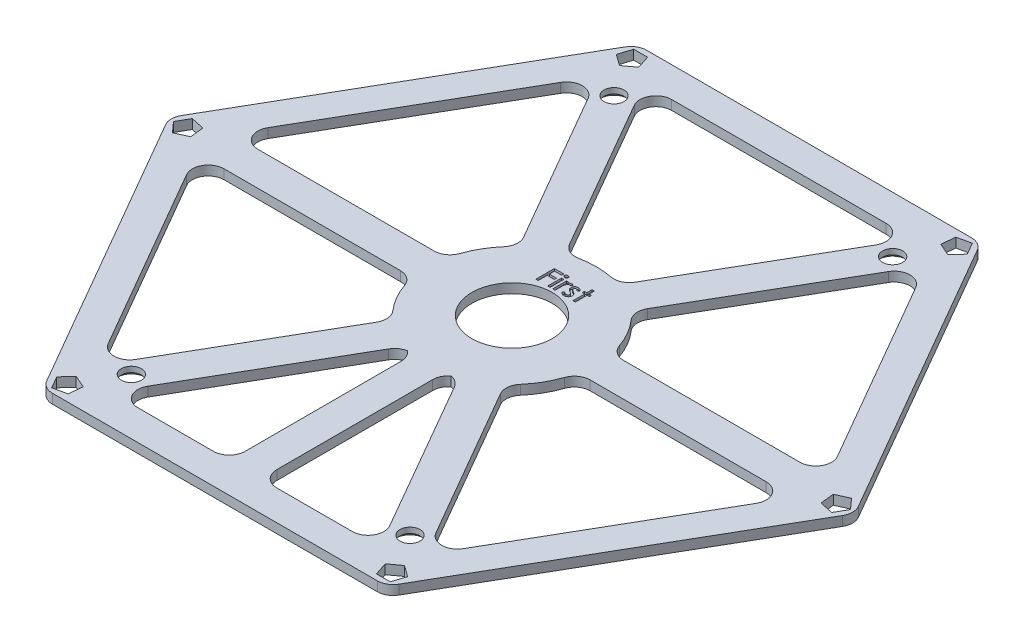
from build123d import *

# Parameters (mm, degrees)
SKETCH1_R           = 1.9
BOSS_EXTRUDE1_DEPTH = 1.8
FILLET1_R           = 3
FILLET2_R           = 3
SKETCH3_R           = 7.6
CUT_EXTRUDE1_DEPTH  = 10
SKETCH4_W           = 0.448717948
SKETCH4_H           = 2.602564103
CUT_EXTRUDE2_DEPTH  = 0.4
CHAMFER1_SIZE       = 0.75
SCALE1_SCALE        = 1.15


with BuildPart() as part:
    # Sketch1 → Boss-Extrude1 (new body)
    with BuildSketch(Plane(origin=(0, 0, 0), x_dir=(1, 0, 0), z_dir=(0, 1, 0))):
        Polygon((-32.5, 56.291651246), (-65, 0), (-32.5, -56.291651246), (32.5, -56.291651246), (65, 0), (32.5, 56.291651246), align=None)
        with Locations(Location((-26.4, 45.72614132, 0), (0, 0, 270))):
            Circle(SKETCH1_R, mode=Mode.SUBTRACT)
        with Locations(Location((26.4, 45.72614132, 0), (0, 0, 270))):
            Circle(SKETCH1_R, mode=Mode.SUBTRACT)
        with Locations(Location((26.4, -45.72614132, 0), (0, 0, 270))):
            Circle(SKETCH1_R, mode=Mode.SUBTRACT)
        with Locations(Location((-26.4, -45.72614132, 0), (0, 0, 270))):
            Circle(SKETCH1_R, mode=Mode.SUBTRACT)
        with BuildLine():
            Line((-31.050008497, 47.37157487), (-56.549991503, 3.204308711))
            Line((-56.549991503, 3.204308711), (-15.675854225, 3.204308711))
            ThreePointArc((-15.675854225, 3.204308711), (-13.856406461, 8), (-10.612939858, 11.973533629))
            Line((-10.612939858, 11.973533629), (-31.050008497, 47.37157487))
        make_face(mode=Mode.SUBTRACT)
        with BuildLine():
            Line((-56.549991503, -3.204308711), (-31.050008497, -47.37157487))
            Line((-31.050008497, -47.37157487), (-10.612939858, -11.973533629))
            ThreePointArc((-10.612939858, -11.973533629), (-13.856406461, -8), (-15.675854225, -3.204308711))
            Line((-15.675854225, -3.204308711), (-56.549991503, -3.204308711))
        make_face(mode=Mode.SUBTRACT)
        with BuildLine():
            Line((-25.499983006, -50.575883581), (-3, -50.575883581))
            Line((-3, -50.575883581), (-3, -15.716233646))
            ThreePointArc((-3, -15.716233646), (-4.040434794, -15.481436842), (-5.062914367, -15.17784234))
            Line((-5.062914367, -15.17784234), (-25.499983006, -50.575883581))
        make_face(mode=Mode.SUBTRACT)
        with BuildLine():
            Line((31.050008497, -47.37157487), (56.549991503, -3.204308711))
            Line((56.549991503, -3.204308711), (15.685493875, -3.156783473))
            ThreePointArc((15.685493875, -3.156783473), (13.8685138, -7.978992729), (10.612939858, -11.973533629))
            Line((10.612939858, -11.973533629), (31.050008497, -47.37157487))
        make_face(mode=Mode.SUBTRACT)
        with BuildLine():
            Line((56.549991503, 3.204308711), (31.050008497, 47.37157487))
            Line((31.050008497, 47.37157487), (10.576601619, 12.00564443))
            ThreePointArc((10.576601619, 12.00564443), (13.8442673, 8.020988899), (15.675854225, 3.204308711))
            Line((15.675854225, 3.204308711), (56.549991503, 3.204308711))
        make_face(mode=Mode.SUBTRACT)
        with BuildLine():
            Line((25.499983006, 50.575883581), (-25.499983006, 50.575883581))
            Line((-25.499983006, 50.575883581), (-5.108892256, 15.162427903))
            ThreePointArc((-5.108892256, 15.162427903), (-0.0242465, 15.999981628), (5.062914367, 15.17784234))
            Line((5.062914367, 15.17784234), (25.499983006, 50.575883581))
        make_face(mode=Mode.SUBTRACT)
        Polygon((28.926541222, 52.315471461), (31.319181202, 51.258876955), (33.063428707, 53.207907141), (31.748792971, 55.469068546), (29.192055897, 54.917512964), align=None, mode=Mode.SUBTRACT)
        Polygon((-30.843256685, 51.208855273), (-28.731899012, 52.752645025), (-29.547684912, 55.237722767), (-32.163226, 55.229795525), (-32.963933391, 52.739818478), align=None, mode=Mode.SUBTRACT)
        with BuildLine():
            Line((5.108892256, -15.162427903), (25.499983006, -50.575883581))
            Line((25.499983006, -50.575883581), (3, -50.575883581))
            Line((3, -50.575883581), (3, -15.716233646))
            ThreePointArc((3, -15.716233646), (4.063890821, -15.475296165), (5.108892256, -15.162427903))
        make_face(mode=Mode.SUBTRACT)
        Polygon((59.769797908, 1.106616188), (60.051080214, -1.493768069), (62.61111362, -2.029815626), (63.912018971, 0.239273021), (62.155989288, 2.177694486), align=None, mode=Mode.SUBTRACT)
        Polygon((30.843256685, -51.208855273), (28.731899012, -52.752645025), (29.547684912, -55.237722767), (32.163226, -55.229795525), (32.963933391, -52.739818478), align=None, mode=Mode.SUBTRACT)
        Polygon((-28.926541222, -52.315471461), (-31.319181202, -51.258876955), (-33.063428707, -53.207907141), (-31.748792971, -55.469068546), (-29.192055897, -54.917512964), align=None, mode=Mode.SUBTRACT)
        Polygon((-59.769797908, -1.106616188), (-60.051080214, 1.493768069), (-62.61111362, 2.029815626), (-63.912018971, -0.239273021), (-62.155989288, -2.177694486), align=None, mode=Mode.SUBTRACT)
    extrude(amount=BOSS_EXTRUDE1_DEPTH)

    # Fillet1
    fillet1_edges = [part.edges().sort_by_distance(p)[0] for p in [
        (32.5, 0.9, -56.291651246),
        (65, 0.9, 0),
        (32.5, 0.9, 56.291651246),
        (-32.5, 0.9, 56.291651246),
        (-65, 0.9, 0),
        (-32.5, 0.9, -56.291651246),
    ]]
    fillet(fillet1_edges, radius=FILLET1_R)

    # Fillet2
    # the kernel refuses this fillet: 3 mm, written as the material it adds along each edge
    with BuildSketch(Plane(origin=(5.108892256, 0, 15.162427903), x_dir=(0.49899247865454727, 0, 0.8666063156048375), z_dir=(0, 1, 0))) as fillet2_piece_1:
        with BuildLine():
            CenterArc((2.291900346, -3), FILLET2_R, 90, 71.150645984)
            ThreePointArc((-0.547213591, -2.03075697), (-0.240202934, -1.024379585), (0, 0))
            Line((0, 0), (2.291900346, 0))
        make_face()
    extrude(amount=1.8)
    with BuildSketch(Plane(origin=(3, 0, 15.716233646), x_dir=(0, 0, 1), z_dir=(0, 1, 0))) as fillet2_piece_2:
        with BuildLine():
            CenterArc((2.311522732, 3), FILLET2_R, 198.408480171, 71.591519829)
            ThreePointArc((-0.534965117, 2.052631579), (-0.233429176, 1.035190919), (0, 0))
            Line((0, 0), (2.311522732, 0))
        make_face()
    extrude(amount=1.8)
    with BuildSketch(Plane(origin=(3, 0, 50.575883581), x_dir=(1, 0, 0), z_dir=(0, 1, 0)), Plane(origin=(-3, 0, 50.575883581), x_dir=(0, 0, -1), z_dir=(0, 1, 0))) as fillet2_piece_3:
        with BuildLine():
            CenterArc((FILLET2_R, FILLET2_R), FILLET2_R, 180, 90)
            Line((0, FILLET2_R), (0, 0))
            Line((0, 0), (FILLET2_R, 0))
        make_face()
    extrude(amount=1.8)
    with BuildSketch(Plane(origin=(25.499983006, 0, 50.575883581), x_dir=(-0.49899247865454704, 0, -0.8666063156048377), z_dir=(0, 1, 0)), Plane(origin=(-25.499983006, 0, -50.575883581), x_dir=(0.49899247865454854, 0, 0.8666063156048366), z_dir=(0, 1, 0)), Plane(origin=(31.050008497, 0, -47.37157487), x_dir=(-0.5010068450665456, 0, 0.8654433206146238), z_dir=(0, 1, 0)), Plane(origin=(56.549991503, 0, 3.204308711), x_dir=(-0.9999993237210977, 0, -0.0011629949902190024), z_dir=(0, 1, 0))) as fillet2_piece_4:
        with BuildLine():
            CenterArc((FILLET2_R * 1.72972715714, FILLET2_R), FILLET2_R, 150.06663472, 119.93336528)
            Line((FILLET2_R * 0.86312084154, FILLET2_R * 1.49899247865), (0, 0))
            Line((0, 0), (FILLET2_R * 1.72972715714, 0))
        make_face()
    extrude(amount=1.8)
    with BuildSketch(Plane(origin=(-5.108892256, 0, -15.162427903), x_dir=(0.9665890145022106, 0, -0.25633118624865964), z_dir=(0, 1, 0)), Plane(origin=(10.576601619, 0, -12.00564443), x_dir=(0.7052838263247353, 0, 0.7089250484534599), z_dir=(0, 1, 0)), Plane(origin=(15.685493875, 0, 3.156783473), x_dir=(-0.2613051881774713, 0, 0.965256234702235), z_dir=(0, 1, 0))) as fillet2_piece_5:
        with BuildLine():
            CenterArc((2.30036625, 2.993513373), FILLET2_R, 195.08088677, 71.150645984)
            Line((-0.596312186, 2.212966103), (0, 0))
            ThreePointArc((0, 0), (1.051596, 0.034595343), (2.103192, 0))
        make_face()
    extrude(amount=1.8)
    with BuildSketch(Plane(origin=(5.062914367, 0, -15.17784234), x_dir=(-0.9672937986304155, 0, -0.2536586429261594), z_dir=(0, 1, 0)), Plane(origin=(-5.062914367, 0, 15.17784234), x_dir=(0.967293798630383, 0, 0.2536586429262838), z_dir=(0, 1, 0)), Plane(origin=(15.675854225, 0, -3.204308711), x_dir=(-0.26397207065164496, 0, -0.9645303240001751), z_dir=(0, 1, 0)), Plane(origin=(-15.675854225, 0, 3.204308711), x_dir=(0.2639720706516184, 0, 0.9645303240001825), z_dir=(0, 1, 0))) as fillet2_piece_6:
        with BuildLine():
            CenterArc((2.291044831, -2.993565893), FILLET2_R, 93.753174945, 70.940943034)
            Line((-0.602546141, -2.201649681), (0, 0))
            ThreePointArc((0, 0), (1.04733478, -0.03431524), (2.094669559, 0))
        make_face()
    extrude(amount=1.8)
    with BuildSketch(Plane(origin=(25.499983006, 0, -50.575883581), x_dir=(-1, 0, 0), z_dir=(0, 1, 0)), Plane(origin=(-25.499983006, 0, 50.575883581), x_dir=(1, 0, 0), z_dir=(0, 1, 0)), Plane(origin=(56.549991503, 0, -3.204308711), x_dir=(-0.5000000000000002, 0, -0.8660254037844386), z_dir=(0, 1, 0)), Plane(origin=(-56.549991503, 0, -3.204308711), x_dir=(1, 0, 0), z_dir=(0, 1, 0)), Plane(origin=(-31.050008497, 0, 47.37157487), x_dir=(0.5, 0, -0.8660254037844386), z_dir=(0, 1, 0)), Plane(origin=(-56.549991503, 0, 3.204308711), x_dir=(0.5, 0, 0.8660254037844386), z_dir=(0, 1, 0))) as fillet2_piece_7:
        with BuildLine():
            CenterArc((FILLET2_R * 1.73205080757, FILLET2_R), FILLET2_R, 150, 120)
            Line((FILLET2_R * 0.866025403784, FILLET2_R * 1.5), (0, 0))
            Line((0, 0), (FILLET2_R * 1.73205080757, 0))
        make_face()
    extrude(amount=1.8)
    with BuildSketch(Plane(origin=(-3, 0, 15.716233646), x_dir=(-0.9676752793507856, 0, -0.25219943246046156), z_dir=(0, 1, 0))) as fillet2_piece_8:
        with BuildLine():
            CenterArc((2.320061117, 2.993401703), FILLET2_R, 194.607701523, 71.591519829)
            Line((-0.582964721, 2.236803405), (0, 0))
            ThreePointArc((0, 0), (1.060599368, 0.035190919), (2.121198736, 0))
        make_face()
    extrude(amount=1.8)
    with BuildSketch(Plane(origin=(10.612939858, 0, 11.973533629), x_dir=(0.49999999999999845, 0, 0.8660254037844395), z_dir=(0, 1, 0)), Plane(origin=(-10.612939858, 0, -11.973533629), x_dir=(-0.4999999999999982, 0, -0.8660254037844396), z_dir=(0, 1, 0))) as fillet2_piece_9:
        with BuildLine():
            CenterArc((2.282613232, 3), FILLET2_R, 199.059056966, 70.940943034)
            ThreePointArc((-0.552934261, 2.020372309), (-0.243369041, 1.019244419), (0, 0))
            Line((0, 0), (2.282613232, 0))
        make_face()
    extrude(amount=1.8)
    with BuildSketch(Plane(origin=(31.050008497, 0, 47.37157487), x_dir=(-0.4999999999999989, 0, -0.8660254037844393), z_dir=(0, 1, 0)), Plane(origin=(-31.050008497, 0, -47.37157487), x_dir=(0.4999999999999983, 0, 0.8660254037844396), z_dir=(0, 1, 0))) as fillet2_piece_10:
        with BuildLine():
            CenterArc((FILLET2_R * 1.73205080757, -FILLET2_R), FILLET2_R, 90, 120)
            Line((FILLET2_R * 0.866025403784, -FILLET2_R * 1.5), (0, 0))
            Line((0, 0), (FILLET2_R * 1.73205080757, 0))
        make_face()
    extrude(amount=1.8)
    with BuildSketch(Plane(origin=(-10.612939858, 0, 11.973533629), x_dir=(-0.7033217279791141, 0, -0.7108716810736472), z_dir=(0, 1, 0)), Plane(origin=(-15.675854225, 0, -3.204308711), x_dir=(0.26397207065111183, 0, -0.964530324000321), z_dir=(0, 1, 0))) as fillet2_piece_11:
        with BuildLine():
            CenterArc((2.291044831, 2.993565893), FILLET2_R, 195.305882021, 70.940943034)
            Line((-0.602546141, 2.201649681), (0, 0))
            ThreePointArc((0, 0), (1.04733478, 0.03431524), (2.094669559, 0))
        make_face()
    extrude(amount=1.8)

    # Sketch3 → Cut-Extrude1 (cut)
    with BuildSketch(Plane(origin=(0, 3.6, 0), x_dir=(1, 0, 0), z_dir=(0, 1, 0))):
        with Locations(Location((0, 0, 0), (0, 0, 270))):
            Circle(SKETCH3_R)
    extrude(amount=-CUT_EXTRUDE1_DEPTH, mode=Mode.SUBTRACT)

    # Sketch4 → Cut-Extrude2 (cut)
    with BuildSketch(Plane(origin=(0, 1.8, 0), x_dir=(1, 0, 0), z_dir=(0, 1, 0))):
        Polygon((-3.701923077, 11.722038322), (-1.907051282, 11.722038322), (-1.907051282, 11.318192168), (-3.253205128, 11.318192168), (-3.253205128, 10.331012681), (-1.907051282, 10.331012681), (-1.907051282, 9.927166527), (-3.253205128, 9.927166527), (-3.253205128, 8.222038322), (-3.701923077, 8.222038322), align=None)
        with BuildLine():
            add(Edge.make_bspline(
                [(-1.2578125, 11.856653707), (-1.230830798, 11.855472102), (-1.178773954, 11.853192386), (-1.104578859, 11.834857966), (-1.038258745, 11.803327509), (-0.981761212, 11.759886259), (-0.934938778, 11.710128109), (-0.900272423, 11.656381024), (-0.879426736, 11.599398585), (-0.876468422, 11.560471293), (-0.875, 11.541148899)],
                knots=[0, 0, 0, 0, 1.180073081, 2.27676073, 3.320042968, 4.371717959, 5.377874923, 6.297457691, 7.154906711, 8, 8, 8, 8], degree=3))
            add(Edge.make_bspline(
                [(-0.875, 11.541148899), (-0.876471283, 11.52206049), (-0.879436535, 11.483589341), (-0.900268653, 11.427261924), (-0.93520205, 11.374235083), (-0.981513012, 11.324434406), (-1.038512146, 11.281876097), (-1.104543489, 11.250198804), (-1.178783783, 11.231922548), (-1.230834153, 11.229634501), (-1.2578125, 11.228448579)],
                knots=[0, 0, 0, 0, 0.838561902, 1.690053866, 2.604955955, 3.615478493, 4.665551833, 5.713360726, 6.814806749, 8, 8, 8, 8], degree=3))
            add(Edge.make_bspline(
                [(-1.2578125, 11.228448579), (-1.280159867, 11.229355775), (-1.323725812, 11.231124343), (-1.386007782, 11.250059913), (-1.444027384, 11.278023497), (-1.49523409, 11.318168486), (-1.538454016, 11.365586819), (-1.570557047, 11.419555466), (-1.589266612, 11.47894441), (-1.591709916, 11.520220911), (-1.592948718, 11.541148899)],
                knots=[0, 0, 0, 0, 1.050897616, 2.04871332, 3.044517726, 4.074156936, 5.096691018, 6.055190702, 7.01394389, 8, 8, 8, 8], degree=3))
            add(Edge.make_bspline(
                [(-1.592948718, 11.541148899), (-1.591761613, 11.562555683), (-1.589445392, 11.604323547), (-1.570373939, 11.664273278), (-1.538690869, 11.718709963), (-1.495234832, 11.766278394), (-1.443838995, 11.806214479), (-1.386018136, 11.835362796), (-1.323428597, 11.853767617), (-1.279907621, 11.855681865), (-1.2578125, 11.856653707)],
                knots=[0, 0, 0, 0, 1.003476519, 1.957934027, 2.921620235, 3.939572868, 4.964598795, 5.960849032, 6.964745478, 8, 8, 8, 8], degree=3))
        make_face()
        with Locations((-1.233974359, 9.523320374)):
            Rectangle(SKETCH4_W, SKETCH4_H)
        with BuildLine():
            Line((-0.516025641, 10.824602425), (-0.067307692, 10.824602425))
            Line((-0.067307692, 10.824602425), (-0.067307692, 10.455111239))
            add(Edge.make_bspline(
                [(-0.067307692, 10.455111239), (-0.064600124, 10.472004339), (-0.059315334, 10.504977273), (-0.045984736, 10.552360937), (-0.027546802, 10.596352953), (-0.0043715, 10.637003377), (0.023112874, 10.67446661), (0.055185239, 10.708508615), (0.091696402, 10.739606219), (0.146934683, 10.775150336), (0.219458932, 10.812744805), (0.31045742, 10.845371116), (0.403615699, 10.866039983), (0.466842015, 10.868328451), (0.498497596, 10.86947422)],
                knots=[0, 0, 0, 0, 0.801625561, 1.56465941, 2.301277113, 3.032414989, 3.753384473, 4.4742707, 5.220602463, 5.995500889, 7.548895402, 9.039144265, 10.517585467, 12, 12, 12, 12], degree=3))
            add(Edge.make_bspline(
                [(0.498497596, 10.86947422), (0.52712859, 10.867774008), (0.587278775, 10.864202072), (0.67967221, 10.840386733), (0.776961993, 10.801080866), (0.841223479, 10.765946188), (0.875, 10.747479027)],
                knots=[0, 0, 0, 0, 0.858860638, 1.804360244, 2.845948385, 4, 4, 4, 4], degree=3))
            Line((0.875, 10.747479027), (0.662560096, 10.421457393))
            add(Edge.make_bspline(
                [(0.662560096, 10.421457393), (0.63832775, 10.428312253), (0.594059772, 10.440834804), (0.533040484, 10.453592088), (0.484761903, 10.463260698), (0.456458428, 10.464925384), (0.444511218, 10.465628066)],
                knots=[0, 0, 0, 0, 1.354987806, 2.475310119, 3.356411532, 4, 4, 4, 4], degree=3))
            add(Edge.make_bspline(
                [(0.444511218, 10.465628066), (0.424934811, 10.464192491), (0.383731221, 10.461170955), (0.322267034, 10.43742265), (0.259160228, 10.400782748), (0.207168375, 10.359756611), (0.165458325, 10.319655872), (0.135616991, 10.28287197), (0.106654796, 10.241241831), (0.079465865, 10.194343882), (0.054374054, 10.142138697), (0.030644084, 10.0852284), (0.007849388, 10.023397981), (-0.004718574, 9.979840175), (-0.011217949, 9.957314765)],
                knots=[0, 0, 0, 0, 0.965356871, 2.031842204, 3.216327082, 4.56533618, 5.292082419, 6.07124699, 6.900886396, 7.796081313, 8.746333432, 9.760722644, 10.841983902, 12, 12, 12, 12], degree=3))
            add(Edge.make_bspline(
                [(-0.011217949, 9.957314765), (-0.015963635, 9.938680453), (-0.026611294, 9.896871583), (-0.036635634, 9.825896871), (-0.046728462, 9.741087539), (-0.05382824, 9.642104356), (-0.060371849, 9.529229952), (-0.064093913, 9.402044269), (-0.067180416, 9.26064871), (-0.067263956, 9.16154377), (-0.067307692, 9.109658515)],
                knots=[0, 0, 0, 0, 0.541796663, 1.215601946, 2.018210726, 2.950106988, 4.012619945, 5.205915212, 6.537188929, 8, 8, 8, 8], degree=3))
            Line((-0.067307692, 9.109658515), (-0.067307692, 8.222038322))
            Line((-0.067307692, 8.222038322), (-0.516025641, 8.222038322))
            Line((-0.516025641, 8.222038322), (-0.516025641, 10.824602425))
        make_face()
        with BuildLine():
            Line((2.445512821, 10.456513483), (2.158754006, 10.196397297))
            add(Edge.make_bspline(
                [(2.158754006, 10.196397297), (2.137765161, 10.217724814), (2.097369248, 10.258772547), (2.034878306, 10.313060607), (1.975235706, 10.360177756), (1.917011951, 10.398128275), (1.860797877, 10.428078966), (1.806514753, 10.449381928), (1.754171119, 10.462980972), (1.719691194, 10.464765493), (1.70302484, 10.465628066)],
                knots=[0, 0, 0, 0, 1.323954473, 2.548132, 3.661338868, 4.685637623, 5.620299102, 6.475132344, 7.262933916, 8, 8, 8, 8], degree=3))
            add(Edge.make_bspline(
                [(1.70302484, 10.465628066), (1.688394174, 10.464730797), (1.658778231, 10.462914512), (1.615821688, 10.44612836), (1.574640003, 10.420046825), (1.535200431, 10.385588757), (1.500719889, 10.342613362), (1.476090495, 10.291815484), (1.460744421, 10.234909432), (1.459160283, 10.194865236), (1.458333333, 10.173961399)],
                knots=[0, 0, 0, 0, 0.832490187, 1.685157841, 2.595972223, 3.607628721, 4.662023247, 5.718189086, 6.808851023, 8, 8, 8, 8], degree=3))
            add(Edge.make_bspline(
                [(1.458333333, 10.173961399), (1.45906256, 10.155173716), (1.460484047, 10.118550784), (1.47387619, 10.066144756), (1.493677438, 10.017001341), (1.514474317, 9.98895602), (1.524939904, 9.97484281)],
                knots=[0, 0, 0, 0, 1.051456026, 2.049608974, 3.018507243, 4, 4, 4, 4], degree=3))
            add(Edge.make_bspline(
                [(1.524939904, 9.97484281), (1.543113427, 9.954659735), (1.582793919, 9.910591543), (1.659908628, 9.85143542), (1.754028801, 9.788846199), (1.824920162, 9.749707042), (1.862880609, 9.72874906)],
                knots=[0, 0, 0, 0, 0.773884963, 1.689718389, 2.762905336, 4, 4, 4, 4], degree=3))
            add(Edge.make_bspline(
                [(1.862880609, 9.72874906), (1.892899549, 9.712341532), (1.950598953, 9.680804625), (2.0320041, 9.632437135), (2.105419765, 9.585175853), (2.17132493, 9.539407004), (2.228892107, 9.493916493), (2.278153961, 9.449533993), (2.320398785, 9.407031499), (2.343425275, 9.377022933), (2.354366987, 9.362763483)],
                knots=[0, 0, 0, 0, 1.33001518, 2.556422155, 3.680542608, 4.724184501, 5.674971885, 6.530695486, 7.30181686, 8, 8, 8, 8], degree=3))
            add(Edge.make_bspline(
                [(2.354366987, 9.362763483), (2.375268711, 9.330138271), (2.41615456, 9.266320112), (2.458866653, 9.162790883), (2.485583749, 9.056794696), (2.488783692, 8.985013554), (2.490384615, 8.949101624)],
                knots=[0, 0, 0, 0, 1.049962625, 2.053831286, 3.026336549, 4, 4, 4, 4], degree=3))
            add(Edge.make_bspline(
                [(2.490384615, 8.949101624), (2.489799594, 8.923580973), (2.488645114, 8.873218548), (2.476812439, 8.79927063), (2.458785969, 8.727714241), (2.432414685, 8.65881031), (2.399504576, 8.592024588), (2.359080666, 8.527679806), (2.311264285, 8.465854076), (2.256198307, 8.407529662), (2.195730968, 8.353928469), (2.130731691, 8.306299256), (2.061359595, 8.266333902), (1.987377064, 8.234056774), (1.909726504, 8.207496532), (1.826951674, 8.190888548), (1.740539713, 8.178795202), (1.681335654, 8.177716607), (1.651141827, 8.177166527)],
                knots=[0, 0, 0, 0, 0.963489602, 1.901349341, 2.822262455, 3.747230613, 4.683134612, 5.631288318, 6.613293617, 7.631511985, 8.657397281, 9.662358437, 10.671075458, 11.675221639, 12.708377436, 13.76481686, 14.860065804, 16, 16, 16, 16], degree=3))
            add(Edge.make_bspline(
                [(1.651141827, 8.177166527), (1.61414115, 8.178419753), (1.540394783, 8.180917568), (1.431278113, 8.199833197), (1.324455484, 8.230077833), (1.220963079, 8.272673907), (1.122108833, 8.327857776), (1.031367124, 8.397762997), (0.946822978, 8.478922425), (0.899189987, 8.541978833), (0.875, 8.574001463)],
                knots=[0, 0, 0, 0, 0.979216887, 1.951685614, 2.923149898, 3.913640395, 4.908296688, 5.910698089, 6.938966812, 8, 8, 8, 8], degree=3))
            Line((0.875, 8.574001463), (1.139322917, 8.850243451))
            add(Edge.make_bspline(
                [(1.139322917, 8.850243451), (1.161723955, 8.828910625), (1.20493419, 8.787760907), (1.271640345, 8.733177913), (1.33612569, 8.686566969), (1.398745524, 8.648158381), (1.459799851, 8.618481912), (1.519179608, 8.597043839), (1.576926395, 8.5836468), (1.615086291, 8.581873607), (1.633613782, 8.581012681)],
                knots=[0, 0, 0, 0, 1.288506075, 2.485449601, 3.588003455, 4.601705531, 5.542438646, 6.411005369, 7.228507225, 8, 8, 8, 8], degree=3))
            add(Edge.make_bspline(
                [(1.633613782, 8.581012681), (1.66107436, 8.582403581), (1.714626078, 8.585116017), (1.791933678, 8.60511304), (1.862410772, 8.639283422), (1.924228436, 8.686284703), (1.975773667, 8.741450471), (2.014218484, 8.802617279), (2.037089336, 8.869251859), (2.040127878, 8.915276732), (2.041666667, 8.938584797)],
                knots=[0, 0, 0, 0, 1.096025125, 2.137392371, 3.164312155, 4.204088696, 5.221248568, 6.164137697, 7.070276657, 8, 8, 8, 8], degree=3))
            add(Edge.make_bspline(
                [(2.041666667, 8.938584797), (2.040714934, 8.957609289), (2.038843244, 8.995023115), (2.024147203, 9.049431493), (2.00021299, 9.100969212), (1.977071601, 9.131310831), (1.965244391, 9.14681797)],
                knots=[0, 0, 0, 0, 1.00762038, 1.981599971, 2.968426558, 4, 4, 4, 4], degree=3))
            add(Edge.make_bspline(
                [(1.965244391, 9.14681797), (1.957681061, 9.155147515), (1.941095224, 9.173413608), (1.910458638, 9.1997488), (1.873542277, 9.228030427), (1.830399635, 9.258785995), (1.779727023, 9.289614127), (1.723054921, 9.323669208), (1.659093048, 9.358307608), (1.614238458, 9.381972148), (1.590845353, 9.394313963)],
                knots=[0, 0, 0, 0, 0.598311898, 1.312054841, 2.145484848, 3.073753233, 4.129800786, 5.300877464, 6.592321185, 8, 8, 8, 8], degree=3))
            add(Edge.make_bspline(
                [(1.590845353, 9.394313963), (1.564075097, 9.409051714), (1.512125386, 9.437651438), (1.43875778, 9.482797736), (1.370958559, 9.526484726), (1.310678043, 9.571391999), (1.257053473, 9.616602896), (1.209596772, 9.661106255), (1.167875957, 9.705166505), (1.145312916, 9.736670017), (1.134415064, 9.751886079)],
                knots=[0, 0, 0, 0, 1.253912045, 2.433311408, 3.534624239, 4.562802555, 5.515759338, 6.411389838, 7.23270809, 8, 8, 8, 8], degree=3))
            add(Edge.make_bspline(
                [(1.134415064, 9.751886079), (1.11503015, 9.782379823), (1.076382613, 9.843174941), (1.03891728, 9.945362575), (1.013516752, 10.052816443), (1.010931112, 10.127064833), (1.009615385, 10.164846816)],
                knots=[0, 0, 0, 0, 0.987528248, 1.968826629, 2.966418566, 4, 4, 4, 4], degree=3))
            add(Edge.make_bspline(
                [(1.009615385, 10.164846816), (1.009972562, 10.189665593), (1.010673078, 10.238341572), (1.021519024, 10.309231804), (1.035400268, 10.377421969), (1.05788349, 10.441897791), (1.084658575, 10.504228207), (1.119684634, 10.56205903), (1.159071453, 10.617752814), (1.205099632, 10.66907511), (1.256156199, 10.715597307), (1.309894019, 10.75736035), (1.367352559, 10.79208047), (1.428161636, 10.820021263), (1.491829523, 10.842896446), (1.559016764, 10.857698505), (1.628832091, 10.86837379), (1.676572579, 10.869102539), (1.700921474, 10.86947422)],
                knots=[0, 0, 0, 0, 1.077691122, 2.11362841, 3.112019185, 4.098344371, 5.07626173, 6.055497571, 7.031037172, 8.038433535, 9.045112416, 10.030652415, 10.992446082, 11.956062447, 12.936088526, 13.926799257, 14.942613481, 16, 16, 16, 16], degree=3))
            add(Edge.make_bspline(
                [(1.700921474, 10.86947422), (1.732342287, 10.868302663), (1.795790379, 10.865936937), (1.890446885, 10.844982029), (1.984803354, 10.812633556), (2.078755342, 10.767279), (2.171496572, 10.708180397), (2.264369576, 10.636866384), (2.357005213, 10.552654407), (2.415383055, 10.489241783), (2.445512821, 10.456513483)],
                knots=[0, 0, 0, 0, 0.858658356, 1.733890061, 2.639692681, 3.583355905, 4.58026951, 5.642917418, 6.783470838, 8, 8, 8, 8], degree=3))
        make_face()
        Polygon((3.342948718, 11.811781912), (3.791666667, 11.811781912), (3.791666667, 10.824602425), (4.240384615, 10.824602425), (4.240384615, 10.420756271), (3.791666667, 10.420756271), (3.791666667, 8.222038322), (3.342948718, 8.222038322), (3.342948718, 10.420756271), (2.894230769, 10.420756271), (2.894230769, 10.824602425), (3.342948718, 10.824602425), align=None)
    extrude(amount=-CUT_EXTRUDE2_DEPTH, mode=Mode.SUBTRACT)

    # Chamfer1
    chamfer1_edges = [part.edges().sort_by_distance(p)[0] for p in [
        (-26.4, 0, 43.82614132),
        (-26.4, 0, -47.62614132),
        (26.4, 0, -47.62614132),
        (26.4, 0, 43.82614132),
    ]]
    chamfer(chamfer1_edges, length=CHAMFER1_SIZE)


with BuildPart() as part_1:
    # Scale1: scaled about (-0.010321501, 0.90089478, 1.593640656)
    add(part.part.scale(SCALE1_SCALE).moved(Location((0.001548225, -0.135134217, -0.239046098))))


solid = part_1.part
